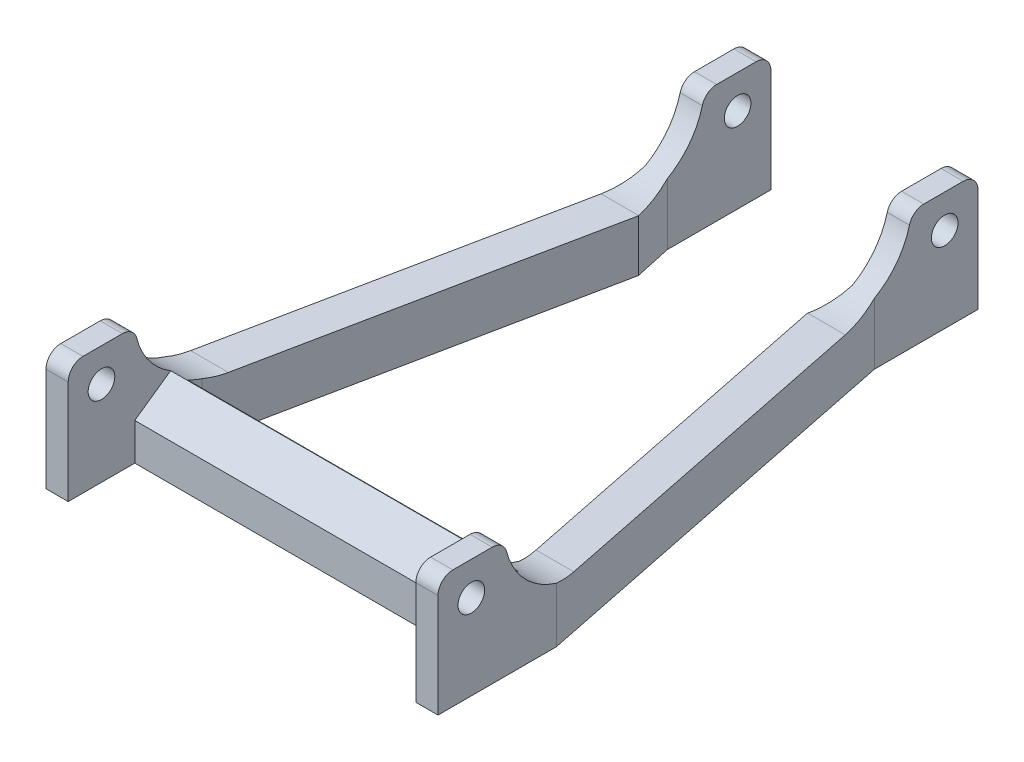
from build123d import *

# Parameters (mm, degrees)
BOSS_EXTRUDE1_DEPTH  = 7
BOSS_EXTRUDE2_START  = 7
SKETCH1_3_W          = 3
SKETCH1_3_H          = 9
BOSS_EXTRUDE2_DEPTH  = 9
M3_CLEARANCE_HOLE1_D = 3.6
CHAMFER1_SIZE        = 2
CHAMFER1_SIZE2       = 2.856296013
FILLET1_R            = 10
FILLET2_R            = 2


with BuildPart() as part:
    # Sketch1 → Boss-Extrude1 (new body)
    with BuildSketch(Plane(origin=(0, 0, 0), x_dir=(1, 0, 0), z_dir=(0, 1, 0))):
        Polygon((-23.5, -9), (-23.5, 0), (23.5, 0), (23.5, -9), (26.5, -9), (26.5, 7), (15.5, 61), (15.5, 75), (12.5, 75), (12.5, 61), (11.415834914, 56), (21.397316395, 7), (21.397316395, 5), (-21.397316395, 5), (-21.397316395, 7), (-11.415834914, 56), (-12.5, 61), (-12.5, 75), (-15.5, 75), (-15.5, 61), (-26.5, 7), (-26.5, -9), align=None)
    extrude(amount=BOSS_EXTRUDE1_DEPTH)

    # Sketch1<3> → Boss-Extrude2 (add)
    with BuildSketch(Plane(origin=(0, 0, 0), x_dir=(1, 0, 0), z_dir=(0, 1, 0)).offset(BOSS_EXTRUDE2_START)):
        with Locations((-14, 70.5)):
            Rectangle(SKETCH1_3_W, SKETCH1_3_H)
        with Locations((14, 70.5)):
            Rectangle(SKETCH1_3_W, SKETCH1_3_H)
        with Locations((-25, -4.5)):
            Rectangle(SKETCH1_3_W, SKETCH1_3_H)
        with Locations((25, -4.5)):
            Rectangle(SKETCH1_3_W, SKETCH1_3_H)
    extrude(amount=BOSS_EXTRUDE2_DEPTH)

    # M3 Clearance Hole1 (through all)
    with Locations(Plane(origin=(26.5, 0, 0), x_dir=(0, 0, -1), z_dir=(1, 0, 0))):
        with Locations((-4.5, 11.5), (70.5, 11.5)):
            Hole(M3_CLEARANCE_HOLE1_D / 2)

    # Chamfer1
    chamfer1_edges = [part.edges().sort_by_distance(p)[0] for p in [
        (0, 7, 0),
    ]]
    chamfer1_side = [part.faces().sort_by_distance(p)[0] for p in [
        (0, 3.5, 0),
    ]]
    chamfer(chamfer1_edges, length=CHAMFER1_SIZE, length2=CHAMFER1_SIZE2, reference=chamfer1_side[0])

    # Fillet1
    # the kernel refuses this fillet: 10 mm, written as the material it adds along each edge
    with BuildSketch(Plane(origin=(-1.374685928, 7, 0), x_dir=(0, 0, -1), z_dir=(1, 0, 0))) as fillet1_piece_1_section:
        with BuildLine():
            CenterArc((9.949874371, 10), FILLET1_R, 185.739170477, 84.260829523)
            Line((0, 9), (0, 0))
            Line((0, 0), (9.949874371, 0))
        make_face()
    fillet1_piece_1 = extrude(amount=27.874685928, mode=Mode.PRIVATE)
    fillet1_piece_1 = split(fillet1_piece_1, bisect_by=Plane(origin=(10.011315234, 8.407248867, -4.866055679), z_dir=(0, -0.819152044288993, -0.5735764363510445)), keep=Keep.TOP, mode=Mode.PRIVATE)
    fillet1_piece_1 = split(fillet1_piece_1, bisect_by=Plane(origin=(10.011315234, 8.336481062, -5), z_dir=(0, 0, 1)), keep=Keep.TOP, mode=Mode.PRIVATE)
    add(fillet1_piece_1)
    with BuildSketch(Plane(origin=(-1.374685928, 7, 0), x_dir=(0, 0, -1), z_dir=(1, 0, 0))) as fillet1_piece_2_section:
        with BuildLine():
            CenterArc((9.949874371, 10), FILLET1_R, 185.739170477, 84.260829523)
            Line((0, 9), (0, 0))
            Line((0, 0), (9.949874371, 0))
        make_face()
    fillet1_piece_2 = extrude(amount=27.874685928, mode=Mode.PRIVATE)
    fillet1_piece_2 = split(fillet1_piece_2, bisect_by=Plane(origin=(26.506585427, 7.804991574, -6.967671542), z_dir=(-0.9798765487080173, 0, 0.19960448214422577)), keep=Keep.TOP, mode=Mode.PRIVATE)
    fillet1_piece_2 = split(fillet1_piece_2, bisect_by=Plane(origin=(21.601020113, 7.804991574, -5), z_dir=(0, 0, -1)), keep=Keep.TOP, mode=Mode.PRIVATE)
    fillet1_piece_2 = split(fillet1_piece_2, bisect_by=Plane(origin=(21.397316395, 7.804991574, -5.968389718), z_dir=(1, 0, 0)), keep=Keep.TOP, mode=Mode.PRIVATE)
    add(fillet1_piece_2)
    with BuildSketch(Plane(origin=(-1.374685928, 7, 0), x_dir=(0, 0, -1), z_dir=(1, 0, 0))) as fillet1_piece_3_section:
        with BuildLine():
            CenterArc((9.949874371, 10), FILLET1_R, 185.739170477, 84.260829523)
            Line((0, 9), (0, 0))
            Line((0, 0), (9.949874371, 0))
        make_face()
    fillet1_piece_3 = extrude(amount=52.749371855, mode=Mode.PRIVATE)
    fillet1_piece_3 = split(fillet1_piece_3, bisect_by=Plane(origin=(20.913958027, 7.01045348, -9.37285017), z_dir=(0.9798765487080173, 0, -0.1996044821442258)), keep=Keep.TOP, mode=Mode.PRIVATE)
    fillet1_piece_3 = split(fillet1_piece_3, bisect_by=Plane(origin=(21.397316395, 7.01045348, -9.450911129), z_dir=(-1, 0, 0)), keep=Keep.TOP, mode=Mode.PRIVATE)
    add(fillet1_piece_3)
    with BuildSketch(Plane(origin=(23.5, 7, 0), x_dir=(0, 0, -1), z_dir=(1, 0, 0))) as fillet1_piece_4_section:
        with BuildLine():
            CenterArc((9.949874371, 10), FILLET1_R, 185.739170477, 84.260829523)
            Line((0, 9), (0, 0))
            Line((0, 0), (9.949874371, 0))
        make_face()
    fillet1_piece_4 = extrude(amount=3, mode=Mode.PRIVATE)
    fillet1_piece_4 = split(fillet1_piece_4, bisect_by=Plane(origin=(25, 11.609815369, -5), z_dir=(0, 0, 1)), keep=Keep.TOP, mode=Mode.PRIVATE)
    add(fillet1_piece_4)
    with BuildSketch(Plane(origin=(-15.5, 7, -66), x_dir=(0, 0, 1), z_dir=(1, 0, 0))) as fillet1_piece_5_section:
        with BuildLine():
            CenterArc((9.949874371, -10), FILLET1_R, 90, 84.260829523)
            Line((0, -9), (0, 0))
            Line((0, 0), (9.949874371, 0))
        make_face()
    fillet1_piece_5 = extrude(amount=27.874685928, mode=Mode.PRIVATE)
    fillet1_piece_5 = split(fillet1_piece_5, bisect_by=Plane(origin=(-13.326382184, 11.537566275, -64.811145527), z_dir=(-0.9772894830316591, 0, 0.21190862737442448)), keep=Keep.TOP, mode=Mode.PRIVATE)
    add(fillet1_piece_5)
    with BuildSketch(Plane(origin=(-40.374685928, 7, -66), x_dir=(0, 0, 1), z_dir=(1, 0, 0))) as fillet1_piece_6_section:
        with BuildLine():
            CenterArc((9.949874371, -10), FILLET1_R, 90, 84.260829523)
            Line((0, -9), (0, 0))
            Line((0, 0), (9.949874371, 0))
        make_face()
    fillet1_piece_6 = extrude(amount=27.874685928, mode=Mode.PRIVATE)
    fillet1_piece_6 = split(fillet1_piece_6, bisect_by=Plane(origin=(-16.305903703, 7.017292707, -57.04374546), z_dir=(0.9798765487080173, 0, 0.19960448214422577)), keep=Keep.TOP, mode=Mode.PRIVATE)
    add(fillet1_piece_6)
    with BuildSketch(Plane(origin=(-40.374685928, 7, -66), x_dir=(0, 0, 1), z_dir=(1, 0, 0))) as fillet1_piece_7_section:
        with BuildLine():
            CenterArc((9.949874371, -10), FILLET1_R, 90, 84.260829523)
            Line((0, -9), (0, 0))
            Line((0, 0), (9.949874371, 0))
        make_face()
    fillet1_piece_7 = extrude(amount=52.749371855, mode=Mode.PRIVATE)
    fillet1_piece_7 = split(fillet1_piece_7, bisect_by=Plane(origin=(11.618519357, 7.008478839, -56.93474899), z_dir=(0.977289483031659, 0, 0.2119086273744248)), keep=Keep.TOP, mode=Mode.PRIVATE)
    add(fillet1_piece_7)
    with BuildSketch(Plane(origin=(-12.374685928, 7, -66), x_dir=(0, 0, 1), z_dir=(1, 0, 0))) as fillet1_piece_8_section:
        with BuildLine():
            CenterArc((9.949874371, -10), FILLET1_R, 90, 84.260829523)
            Line((0, -9), (0, 0))
            Line((0, 0), (9.949874371, 0))
        make_face()
    fillet1_piece_8 = extrude(amount=52.749371855, mode=Mode.PRIVATE)
    fillet1_piece_8 = split(fillet1_piece_8, bisect_by=Plane(origin=(-11.604329561, 7.008478839, -56.869307865), z_dir=(-0.9772894830316591, 0, 0.21190862737442448)), keep=Keep.TOP, mode=Mode.PRIVATE)
    add(fillet1_piece_8)
    with BuildSketch(Plane(origin=(12.5, 7, -66), x_dir=(0, 0, 1), z_dir=(1, 0, 0))) as fillet1_piece_9:
        with BuildLine():
            CenterArc((9.949874371, -10), FILLET1_R, 90, 84.260829523)
            Line((0, -9), (0, 0))
            Line((0, 0), (9.949874371, 0))
        make_face()
    extrude(amount=3)
    with BuildSketch(Plane(origin=(-12.374685928, 7, -66), x_dir=(0, 0, 1), z_dir=(1, 0, 0))) as fillet1_piece_10_section:
        with BuildLine():
            CenterArc((9.949874371, -10), FILLET1_R, 90, 84.260829523)
            Line((0, -9), (0, 0))
            Line((0, 0), (9.949874371, 0))
        make_face()
    fillet1_piece_10 = extrude(amount=52.749371855, mode=Mode.PRIVATE)
    fillet1_piece_10 = split(fillet1_piece_10, bisect_by=Plane(origin=(16.17255533, 7.017292707, -57.698364743), z_dir=(-0.9798765487080173, 0, 0.19960448214422577)), keep=Keep.TOP, mode=Mode.PRIVATE)
    fillet1_piece_10 = split(fillet1_piece_10, bisect_by=Plane(origin=(11.645733853, 7.017292707, -57.060257993), z_dir=(0.977289483031659, 0, 0.2119086273744248)), keep=Keep.TOP, mode=Mode.PRIVATE)
    add(fillet1_piece_10)
    with BuildSketch(Plane(origin=(1.374685928, 7, 0), x_dir=(0, 0, -1), z_dir=(-1, 0, 0))) as fillet1_piece_11_section:
        with BuildLine():
            CenterArc((9.949874371, -10), FILLET1_R, 90, 84.260829523)
            Line((0, -9), (0, 0))
            Line((0, 0), (9.949874371, 0))
        make_face()
    fillet1_piece_11 = extrude(amount=27.874685928, mode=Mode.PRIVATE)
    fillet1_piece_11 = split(fillet1_piece_11, bisect_by=Plane(origin=(-10.011315234, 8.407248867, -4.866055679), z_dir=(0, -0.819152044288993, -0.5735764363510445)), keep=Keep.TOP, mode=Mode.PRIVATE)
    fillet1_piece_11 = split(fillet1_piece_11, bisect_by=Plane(origin=(-10.011315234, 8.336481062, -5), z_dir=(0, 0, 1)), keep=Keep.TOP, mode=Mode.PRIVATE)
    add(fillet1_piece_11)
    with BuildSketch(Plane(origin=(1.374685928, 7, 0), x_dir=(0, 0, -1), z_dir=(-1, 0, 0))) as fillet1_piece_12_section:
        with BuildLine():
            CenterArc((9.949874371, -10), FILLET1_R, 90, 84.260829523)
            Line((0, -9), (0, 0))
            Line((0, 0), (9.949874371, 0))
        make_face()
    fillet1_piece_12 = extrude(amount=27.874685928, mode=Mode.PRIVATE)
    fillet1_piece_12 = split(fillet1_piece_12, bisect_by=Plane(origin=(-26.506585427, 7.804991574, -6.967671542), z_dir=(0.9798765487080173, 0, 0.19960448214422577)), keep=Keep.TOP, mode=Mode.PRIVATE)
    fillet1_piece_12 = split(fillet1_piece_12, bisect_by=Plane(origin=(-21.397316395, 7.804991574, -5.968389718), z_dir=(-1, 0, 0)), keep=Keep.TOP, mode=Mode.PRIVATE)
    fillet1_piece_12 = split(fillet1_piece_12, bisect_by=Plane(origin=(-21.601020113, 7.804991574, -5), z_dir=(0, 0, -1)), keep=Keep.TOP, mode=Mode.PRIVATE)
    add(fillet1_piece_12)
    with BuildSketch(Plane(origin=(1.374685928, 7, 0), x_dir=(0, 0, -1), z_dir=(-1, 0, 0))) as fillet1_piece_13_section:
        with BuildLine():
            CenterArc((9.949874371, -10), FILLET1_R, 90, 84.260829523)
            Line((0, -9), (0, 0))
            Line((0, 0), (9.949874371, 0))
        make_face()
    fillet1_piece_13 = extrude(amount=27.874685928, mode=Mode.PRIVATE)
    fillet1_piece_13 = split(fillet1_piece_13, bisect_by=Plane(origin=(-25.813340771, 7.01045348, -10.370872581), z_dir=(0.9798765487080173, 0, 0.19960448214422577)), keep=Keep.TOP, mode=Mode.PRIVATE)
    fillet1_piece_13 = split(fillet1_piece_13, bisect_by=Plane(origin=(-20.913958027, 7.01045348, -9.37285017), z_dir=(-0.9798765487080173, 0, -0.19960448214422577)), keep=Keep.TOP, mode=Mode.PRIVATE)
    fillet1_piece_13 = split(fillet1_piece_13, bisect_by=Plane(origin=(-21.297166367, 7.01045348, -5), z_dir=(0, 0, -1)), keep=Keep.TOP, mode=Mode.PRIVATE)
    add(fillet1_piece_13)
    with BuildSketch(Plane(origin=(-23.5, 7, 0), x_dir=(0, 0, -1), z_dir=(-1, 0, 0))) as fillet1_piece_14_section:
        with BuildLine():
            CenterArc((9.949874371, -10), FILLET1_R, 90, 84.260829523)
            Line((0, -9), (0, 0))
            Line((0, 0), (9.949874371, 0))
        make_face()
    fillet1_piece_14 = extrude(amount=3, mode=Mode.PRIVATE)
    fillet1_piece_14 = split(fillet1_piece_14, bisect_by=Plane(origin=(-25, 11.609815369, -5), z_dir=(0, 0, 1)), keep=Keep.TOP, mode=Mode.PRIVATE)
    add(fillet1_piece_14)

    # Fillet2
    fillet2_edges = [part.edges().sort_by_distance(p)[0] for p in [
        (25, 16, 9),
        (25, 16, 0),
        (-14, 16, -75),
        (-14, 16, -66),
        (14, 16, -75),
        (14, 16, -66),
        (-25, 16, 9),
        (-25, 16, 0),
    ]]
    fillet(fillet2_edges, radius=FILLET2_R)


solid = part.part
